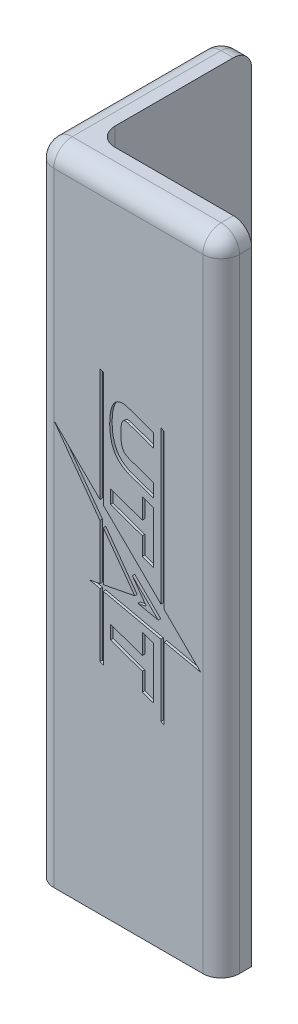
from build123d import *

# Parameters (mm, degrees)
SKETCH1_W           = 25.4
SKETCH1_H           = 100
BOSS_EXTRUDE1_DEPTH = 5
SKETCH2_W           = 5
SKETCH2_H           = 100
BOSS_EXTRUDE2_DEPTH = 30.4
BOSS_EXTRUDE3_DEPTH = 5
FILLET1_R           = 3
FILLET2_R           = 3
FILLET3_R           = 3
FILLET4_R           = 3
CUT_EXTRUDE1_START  = -0.4
CUT_EXTRUDE1_DEPTH  = 0.4
SKETCH5_W           = 0.314102564
SKETCH5_H           = 2.557692308
CUT_EXTRUDE2_DEPTH  = 0.4


# Read off the part's stored shape, not the designer's step: Cut-Extrude1
with BuildPart() as part:
    # Sketch1 → Boss-Extrude1 (new body)
    with BuildSketch(Plane.XY):
        Rectangle(SKETCH1_W, SKETCH1_H)
    extrude(amount=BOSS_EXTRUDE1_DEPTH)

    # Sketch2 → Boss-Extrude2 (add)
    with BuildSketch(Plane.XY.offset(5)):
        with Locations((-15.2, 0)):
            Rectangle(SKETCH2_W, SKETCH2_H)
    extrude(amount=-BOSS_EXTRUDE2_DEPTH)

    # Sketch3 → Boss-Extrude3 (add)
    with BuildSketch(Plane.XZ.offset(50)):
        Polygon((12.7, 0), (-12.7, -25.4), (-17.7, -25.4), (-17.7, 5), (12.7, 5), align=None)
    extrude(amount=BOSS_EXTRUDE3_DEPTH)

    # Fillet1
    fillet1_edges = [part.edges().sort_by_distance(p)[0] for p in [
        (-12.7, -50, -12.7),
        (0, -50, 0),
        (-12.7, 0, 0),
    ]]
    fillet(fillet1_edges, radius=FILLET1_R)

    # Fillet2
    fillet2_edges = [part.edges().sort_by_distance(p)[0] for p in [
        (-17.7, -2.5, -25.4),
        (-17.7, -2.5, 5),
        (12.7, -2.5, 5),
        (-2.5, 50, 5),
    ]]
    fillet(fillet2_edges, radius=FILLET2_R)

    # Fillet3
    # the kernel refuses this fillet: 3 mm, written as the material it takes off along each edge
    with BuildSketch(Plane(origin=(-14.7, 47, 2), x_dir=(-1, 0, 0), z_dir=(0, 1, 0))) as fillet3_piece_1_section:
        Polygon((0, 0), (FILLET3_R, 0), (FILLET3_R, FILLET3_R), (0, FILLET3_R), align=None)
    fillet3_piece_1 = extrude(amount=FILLET3_R, mode=Mode.PRIVATE)
    fillet3_piece_1 = fillet3_piece_1 - Plane(origin=(-14.7, 47, 2), x_dir=(0.7071067811865475, 0, -0.7071067811865475), z_dir=(0, 1, 0)) * Sphere(FILLET3_R, mode=Mode.PRIVATE)
    add(fillet3_piece_1, mode=Mode.SUBTRACT)
    with BuildSketch(Plane(origin=(-5.2, 50, -25.4), x_dir=(0, 0, 1), z_dir=(-1, 0, 0))) as fillet3_piece_2:
        with BuildLine():
            CenterArc((FILLET3_R, -FILLET3_R), FILLET3_R, 90, 90)
            Line((0, -FILLET3_R), (0, 0))
            Line((0, 0), (FILLET3_R, 0))
        make_face()
    extrude(amount=9.5, mode=Mode.SUBTRACT)
    with BuildSketch(Plane(origin=(-17.7, 50, 2), x_dir=(1, 0, 0), z_dir=(0, 0, -1))) as fillet3_piece_3:
        with BuildLine():
            CenterArc((FILLET3_R, FILLET3_R), FILLET3_R, 180, 90)
            Line((0, FILLET3_R), (0, 0))
            Line((0, 0), (FILLET3_R, 0))
        make_face()
    extrude(amount=24.4, mode=Mode.SUBTRACT)
    with BuildSketch(Plane(origin=(-14.7, 50, -22.4), x_dir=(-1, 0, 0), z_dir=(0, 0, 1))) as fillet3_piece_4:
        with BuildLine():
            CenterArc((3 - FILLET3_R, FILLET3_R), FILLET3_R, 270, 90)
            Line((3, FILLET3_R), (3, 0))
            Line((3, 0), (3 - FILLET3_R, 0))
        make_face()
    revolve(axis=Axis((-14.7, 50, -22.4), (0, -1, 0)), revolution_arc=90, mode=Mode.SUBTRACT)

    # Fillet4
    # the kernel refuses this fillet: 3 mm, written as the material it takes off along each edge
    with BuildSketch(Plane(origin=(9.7, 47, 2), x_dir=(1, 0, 0), z_dir=(0, 1, 0))) as fillet4_piece_1_section:
        Polygon((0, 0), (FILLET4_R, 0), (FILLET4_R, -FILLET4_R), (0, -FILLET4_R), align=None)
    fillet4_piece_1 = extrude(amount=FILLET4_R, mode=Mode.PRIVATE)
    fillet4_piece_1 = fillet4_piece_1 - Plane(origin=(9.7, 47, 2), x_dir=(-0.7071067811865475, 0, -0.7071067811865475), z_dir=(0, 1, 0)) * Sphere(FILLET4_R, mode=Mode.PRIVATE)
    add(fillet4_piece_1, mode=Mode.SUBTRACT)
    with BuildSketch(Plane(origin=(12.7, 50, -7.5), x_dir=(-1, 0, 0), z_dir=(0, 0, 1))) as fillet4_piece_2:
        with BuildLine():
            CenterArc((FILLET4_R, FILLET4_R), FILLET4_R, 180, 90)
            Line((0, FILLET4_R), (0, 0))
            Line((0, 0), (FILLET4_R, 0))
        make_face()
    extrude(amount=9.5, mode=Mode.SUBTRACT)

    # Cut-Extrude1 outline → Cut-Extrude1 (cut)
    # profile 1 of 4: a face of its own
    with BuildSketch(Plane.XY.offset(5).offset(CUT_EXTRUDE1_START)):
        with BuildLine():
            Line((1.645380209, 17.682917319), (-2.642067311, 19.188059032))
            add(Edge.make_bspline(
                [(-2.642067311, 19.188059032), (-2.801200075, 19.232650803), (-2.976144999, 19.272472548), (-3.323876675, 19.317451019), (-3.498126802, 19.323191147), (-3.839106834, 19.286973095), (-4.006159349, 19.245053084), (-4.325340549, 19.101871815), (-4.477347509, 19.000476363), (-4.756479391, 18.730845616), (-4.883463975, 18.562522822), (-5.105358898, 18.159723445), (-5.200266583, 17.925279253), (-5.434058371, 17.137502224), (-5.52259268, 16.498535316), (-5.575448942, 15.137748495), (-5.541060665, 14.417748791), (-5.374578808, 13.397224638), (-5.299424723, 13.06696379), (-5.105665434, 12.444626305), (-4.98689332, 12.152716073), (-4.707982457, 11.6212962), (-4.547868114, 11.382021025), (-4.197822474, 10.959462193), (-4.008277099, 10.776191859), (-3.614762131, 10.453442793), (-3.411385687, 10.313097417), (-3.097952368, 10.121764898), (-2.991901525, 10.061202649), (-2.77486058, 9.947734844), (-2.663804274, 9.894688519), (-2.549169917, 9.849066737)],
                knots=[0, 0, 0, 0, 0.0625, 0.0625, 0.125, 0.125, 0.1875, 0.1875, 0.25, 0.25, 0.3125, 0.3125, 0.375, 0.375, 0.5, 0.5, 0.625, 0.625, 0.6875, 0.6875, 0.75, 0.75, 0.8125, 0.8125, 0.875, 0.875, 0.9375, 0.9375, 0.96875, 0.96875, 1, 1, 1, 1], degree=3))
            Line((-2.549169917, 9.849066737), (1.645380209, 8.376537762))
            Line((1.645380209, 8.376537762), (1.645380269, 10.58172453))
            Line((1.645380269, 10.58172453), (-2.374981983, 11.993103154))
            add(Edge.make_bspline(
                [(-2.374981983, 11.993103154), (-2.438543495, 12.023304543), (-2.517307531, 12.061688928), (-2.694418178, 12.148219611), (-2.791899148, 12.197619215), (-2.984415327, 12.322421309), (-3.079212931, 12.398255188), (-3.251768669, 12.586599957), (-3.329560308, 12.699138935), (-3.462790247, 12.960568422), (-3.518341685, 13.10933293), (-3.608223534, 13.43420779), (-3.642658684, 13.610171929), (-3.720185685, 14.159342074), (-3.738354538, 14.55241015), (-3.73619539, 15.295138032), (-3.716367942, 15.644731671), (-3.638028303, 16.243693339), (-3.5789285, 16.49416828), (-3.437209448, 16.767920919), (-3.380883508, 16.842148416), (-3.247335423, 16.952784753), (-3.169885451, 16.9889974), (-2.997738688, 17.023988747), (-2.90271205, 17.022346288), (-2.714108837, 16.995175625), (-2.620183173, 16.968886331), (-2.549169858, 16.95263838)],
                knots=[0, 0, 0, 0, 0.0625, 0.0625, 0.125, 0.125, 0.1875, 0.1875, 0.25, 0.25, 0.3125, 0.3125, 0.375, 0.375, 0.5, 0.5, 0.625, 0.625, 0.75, 0.75, 0.8125, 0.8125, 0.875, 0.875, 0.9375, 0.9375, 1, 1, 1, 1], degree=3))
            Line((-2.549169858, 16.95263838), (1.645380209, 15.480108015))
            Line((1.645380209, 15.480108015), (1.645380209, 17.682917319))
        make_face()
    # profile 2 of 4: a face of its own
    with BuildSketch(Plane.XY.offset(5).offset(CUT_EXTRUDE1_START)):
        Polygon((-0.200299968, -20.013397732), (1.645380209, -20.664639272), (1.645380209, -12.17238883), (-0.21205758, -11.520321169), (-0.21205758, -14.838971891), (-5.412489523, -13.00402502), (-5.412489523, -15.224820175), (-0.200299968, -17.063914337), align=None)
    # profile 3 of 4: a face of its own
    with BuildSketch(Plane.XY.offset(5).offset(CUT_EXTRUDE1_START)):
        Polygon((-0.21205758, -0.802293815), (1.645380209, -1.45422379), (1.645380209, 7.034507296), (-0.21205758, 7.689894042), (-0.21205758, 4.361306927), (-5.439937164, 6.196207903), (-5.439937164, 3.985119663), (-0.21205758, 2.150218687), align=None)
    # profile 4 of 4: a face of its own
    with BuildSketch(Plane.XY.offset(5).offset(CUT_EXTRUDE1_START)):
        Polygon((3.360443662, -11.124054589), (9.364861797, -12.450307407), (3.36157019, -6.530124345), (3.36157019, 18.765806756), (2.831215511, 18.966581128), (2.831215511, -6.015960374), (-6.602546175, 3.28720232), (-6.602546175, 22.153214268), (-7.145439734, 22.346713147), (-7.145439734, 3.822580478), (-14.7, 11.272556982), (-7.145439734, 0.849446259), (-7.145439734, -8.096169033), (-8.800724198, -8.437899151), (-7.138373901, -8.805076279), (-7.138373901, -19.173291721), (-6.602546175, -19.372082152), (-6.602546175, -8.923432626), (2.831215511, -11.007158556), (2.831215511, -22.660420933), (3.360443662, -22.856766381), align=None)
        Polygon((-6.601606359, 0.099114082), (-1.462521155, -6.991337337), (-6.601606359, -7.983395257), align=None, mode=Mode.SUBTRACT)
        Polygon((2.399828385, -8.506788411), (-0.92899238, -7.808040776), (0.44099475, -7.549352445), (-1.848042955, -4.338758685), align=None, mode=Mode.SUBTRACT)
    extrude(amount=CUT_EXTRUDE1_DEPTH, mode=Mode.SUBTRACT)

    # Sketch5 → Cut-Extrude2 (cut)
    with BuildSketch(Plane.ZY.offset(17.7)):
        Polygon((-17.336726826, 2.778801547), (-16.68959141, 2.778801547), (-16.68959141, -0.721198453), (-17.003693974, -0.721198453), (-17.003693974, 2.419827188), (-17.542155512, 2.419827188), align=None)
        with BuildLine():
            add(Edge.make_bspline(
                [(-15.05317314, 2.913416932), (-15.033681825, 2.912512779), (-14.995514085, 2.910742275), (-14.940320817, 2.895580798), (-14.890063805, 2.869881113), (-14.845486072, 2.835401432), (-14.807234186, 2.794851989), (-14.780453475, 2.74759102), (-14.763241079, 2.696532381), (-14.761162524, 2.660917292), (-14.76010423, 2.642783919)],
                knots=[0, 0, 0, 0, 1.055194115, 2.066272739, 3.074728998, 4.095836921, 5.109056067, 6.073838105, 7.019297344, 8, 8, 8, 8], degree=3))
            add(Edge.make_bspline(
                [(-14.76010423, 2.642783919), (-14.76118639, 2.625121266), (-14.763325692, 2.590204291), (-14.78044018, 2.540030819), (-14.807462418, 2.493426535), (-14.845461544, 2.452955825), (-14.890070305, 2.418495205), (-14.940319091, 2.392790466), (-14.995514539, 2.377630329), (-15.033681978, 2.37585964), (-15.05317314, 2.374955393)],
                knots=[0, 0, 0, 0, 0.96129708, 1.900370562, 2.859976407, 3.87933698, 4.906634145, 5.921202961, 6.938410037, 8, 8, 8, 8], degree=3))
            add(Edge.make_bspline(
                [(-15.05317314, 2.374955393), (-15.072441416, 2.375825114), (-15.109944596, 2.37751791), (-15.164311438, 2.393087928), (-15.214139928, 2.418504001), (-15.2588046, 2.452730186), (-15.296034793, 2.493675084), (-15.323133119, 2.540002377), (-15.340208081, 2.590211532), (-15.342352709, 2.625123698), (-15.343437564, 2.642783919)],
                knots=[0, 0, 0, 0, 1.054934014, 2.053291228, 3.073705704, 4.106921865, 5.123545215, 6.088680038, 7.033164197, 8, 8, 8, 8], degree=3))
            add(Edge.make_bspline(
                [(-15.343437564, 2.642783919), (-15.342376477, 2.660914769), (-15.340292436, 2.696524901), (-15.32312032, 2.747619934), (-15.296260512, 2.794601436), (-15.258779948, 2.835626935), (-15.214146488, 2.86987237), (-15.164309743, 2.895283352), (-15.109945044, 2.910854691), (-15.072441568, 2.912547305), (-15.05317314, 2.913416932)],
                knots=[0, 0, 0, 0, 0.98631895, 1.937192651, 2.907499808, 3.917963147, 4.944918757, 5.95915025, 6.951458133, 8, 8, 8, 8], degree=3))
        make_face()
        with Locations((-15.051770897, 0.557647701)):
            Rectangle(SKETCH5_W, SKETCH5_H)
        with BuildLine():
            Line((-14.131899102, 1.836493855), (-13.817796538, 1.836493855))
            Line((-13.817796538, 1.836493855), (-13.817796538, 1.375155714))
            add(Edge.make_bspline(
                [(-13.817796538, 1.375155714), (-13.784258903, 1.416998437), (-13.719177952, 1.4981957), (-13.610793618, 1.604916275), (-13.496249718, 1.6928615), (-13.376247715, 1.762965294), (-13.250624705, 1.81581192), (-13.120146435, 1.853977851), (-12.984031728, 1.87686268), (-12.891467292, 1.87985291), (-12.844639487, 1.88136565)],
                knots=[0, 0, 0, 0, 1.12780773, 2.188550248, 3.19190651, 4.159438251, 5.104880172, 6.052711206, 7.014878035, 8, 8, 8, 8], degree=3))
            add(Edge.make_bspline(
                [(-12.844639487, 1.88136565), (-12.797308853, 1.879620454), (-12.704671385, 1.876204686), (-12.569793323, 1.849187995), (-12.44381993, 1.80304274), (-12.327200374, 1.739830669), (-12.222073161, 1.661224196), (-12.129748309, 1.569646414), (-12.053385062, 1.464310331), (-12.002187699, 1.366587175), (-11.968462051, 1.27989838), (-11.947229713, 1.20565163), (-11.929198732, 1.122933479), (-11.913566984, 1.03199389), (-11.902989872, 0.9321957), (-11.894647581, 0.823948008), (-11.888668886, 0.707285877), (-11.888431679, 0.62659925), (-11.888309358, 0.584991451)],
                knots=[0, 0, 0, 0, 1.235846778, 2.418850247, 3.575807741, 4.728682307, 5.871620074, 6.994088408, 8.11269785, 9.256955736, 9.865816715, 10.540099792, 11.271859618, 12.076849838, 12.949306005, 13.892391288, 14.913166135, 16, 16, 16, 16], degree=3))
            Line((-11.888309358, 0.584991451), (-11.888309358, -0.721198453))
            Line((-11.888309358, -0.721198453), (-12.202411923, -0.721198453))
            Line((-12.202411923, -0.721198453), (-12.202411923, 0.481926547))
            add(Edge.make_bspline(
                [(-12.202411923, 0.481926547), (-12.202605131, 0.516748992), (-12.202974705, 0.583358403), (-12.204140351, 0.678727426), (-12.206950158, 0.765214005), (-12.210898471, 0.842611372), (-12.216677501, 0.910845208), (-12.222700133, 0.970054485), (-12.230065109, 1.020164028), (-12.236628023, 1.05032911), (-12.239571378, 1.063857637)],
                knots=[0, 0, 0, 0, 1.430800155, 2.736877192, 3.918605307, 4.986035426, 5.920637409, 6.731861385, 7.431261377, 8, 8, 8, 8], degree=3))
            add(Edge.make_bspline(
                [(-12.239571378, 1.063857637), (-12.250196909, 1.103568822), (-12.27064777, 1.180000567), (-12.321181753, 1.283674919), (-12.384995934, 1.371873107), (-12.462893783, 1.444049829), (-12.554122859, 1.500220665), (-12.658430002, 1.53919462), (-12.774808642, 1.563570889), (-12.856663025, 1.565998021), (-12.899326987, 1.567263086)],
                knots=[0, 0, 0, 0, 1.084156227, 2.086665306, 3.027808233, 3.945421172, 4.874247719, 5.839848303, 6.874090471, 8, 8, 8, 8], degree=3))
            add(Edge.make_bspline(
                [(-12.899326987, 1.567263086), (-12.92459467, 1.566787081), (-12.974598763, 1.56584508), (-13.048748735, 1.556393782), (-13.120672908, 1.540935326), (-13.191093117, 1.520066689), (-13.258600911, 1.49140442), (-13.325365202, 1.45887505), (-13.388871966, 1.418326838), (-13.450475363, 1.373136216), (-13.507788171, 1.323057009), (-13.56111651, 1.270212499), (-13.60865453, 1.213936895), (-13.651723205, 1.155136947), (-13.688901468, 1.093005109), (-13.721354557, 1.028140803), (-13.748890251, 0.960458654), (-13.762572944, 0.913483593), (-13.769419134, 0.889979432)],
                knots=[0, 0, 0, 0, 1.023777757, 2.026029729, 3.023749952, 4.003683103, 4.997618607, 5.993177895, 7.010360494, 8.046726602, 9.087585522, 10.09234134, 11.086953743, 12.070360549, 13.043493632, 14.017870808, 15.008233677, 16, 16, 16, 16], degree=3))
            add(Edge.make_bspline(
                [(-13.769419134, 0.889979432), (-13.773358783, 0.872724229), (-13.781935191, 0.835160554), (-13.791198371, 0.773516135), (-13.799605947, 0.70220616), (-13.806642905, 0.621313843), (-13.810948322, 0.530555968), (-13.815642719, 0.43032013), (-13.81735178, 0.320206642), (-13.817644134, 0.243544949), (-13.817796538, 0.203581195)],
                knots=[0, 0, 0, 0, 0.615963638, 1.340920617, 2.168419149, 3.115676021, 4.16674242, 5.331190069, 6.6087489, 8, 8, 8, 8], degree=3))
            Line((-13.817796538, 0.203581195), (-13.817796538, -0.721198453))
            Line((-13.817796538, -0.721198453), (-14.131899102, -0.721198453))
            Line((-14.131899102, -0.721198453), (-14.131899102, 1.836493855))
        make_face()
        Polygon((-10.676770897, 2.868545137), (-10.407540128, 2.868545137), (-10.467836602, 2.161113246), (-9.891514487, 2.580384079), (-9.734463205, 2.313957797), (-10.393517692, 2.015981034), (-9.734463205, 1.723613246), (-9.891514487, 1.45578472), (-10.467836602, 1.868745457), (-10.407540128, 1.163416932), (-10.676770897, 1.163416932), (-10.612267692, 1.868745457), (-11.192095416, 1.45578472), (-11.34984782, 1.723613246), (-10.676770897, 2.015981034), (-11.34984782, 2.313957797), (-11.192095416, 2.580384079), (-10.612267692, 2.163917733), align=None)
        Polygon((-8.631598621, 2.778801547), (-7.984463205, 2.778801547), (-7.984463205, -0.721198453), (-8.298565769, -0.721198453), (-8.298565769, 2.419827188), (-8.837027307, 2.419827188), align=None)
        with BuildLine():
            add(Edge.make_bspline(
                [(-6.348044935, 2.913416932), (-6.32855362, 2.912512779), (-6.29038588, 2.910742275), (-6.235192612, 2.895580798), (-6.1849356, 2.869881113), (-6.140357867, 2.835401432), (-6.10210598, 2.794851989), (-6.07532527, 2.74759102), (-6.058112874, 2.696532381), (-6.056034319, 2.660917292), (-6.054976025, 2.642783919)],
                knots=[0, 0, 0, 0, 1.055194115, 2.066272739, 3.074728998, 4.095836921, 5.109056067, 6.073838105, 7.019297344, 8, 8, 8, 8], degree=3))
            add(Edge.make_bspline(
                [(-6.054976025, 2.642783919), (-6.056058185, 2.625121266), (-6.058197487, 2.590204291), (-6.075311975, 2.540030819), (-6.102334213, 2.493426535), (-6.140333339, 2.452955825), (-6.1849421, 2.418495205), (-6.235190885, 2.392790466), (-6.290386334, 2.377630329), (-6.328553773, 2.37585964), (-6.348044935, 2.374955393)],
                knots=[0, 0, 0, 0, 0.96129708, 1.900370562, 2.859976407, 3.87933698, 4.906634145, 5.921202961, 6.938410037, 8, 8, 8, 8], degree=3))
            add(Edge.make_bspline(
                [(-6.348044935, 2.374955393), (-6.367313211, 2.375825114), (-6.404816391, 2.37751791), (-6.459183233, 2.393087928), (-6.509011722, 2.418504001), (-6.553676395, 2.452730186), (-6.590906588, 2.493675084), (-6.618004914, 2.540002377), (-6.635079875, 2.590211532), (-6.637224504, 2.625123698), (-6.638309358, 2.642783919)],
                knots=[0, 0, 0, 0, 1.054934014, 2.053291228, 3.073705704, 4.106921865, 5.123545215, 6.088680038, 7.033164197, 8, 8, 8, 8], degree=3))
            add(Edge.make_bspline(
                [(-6.638309358, 2.642783919), (-6.637248272, 2.660914769), (-6.635164231, 2.696524901), (-6.617992115, 2.747619934), (-6.591132307, 2.794601436), (-6.553651743, 2.835626935), (-6.509018283, 2.86987237), (-6.459181538, 2.895283352), (-6.404816838, 2.910854691), (-6.367313362, 2.912547305), (-6.348044935, 2.913416932)],
                knots=[0, 0, 0, 0, 0.98631895, 1.937192651, 2.907499808, 3.917963147, 4.944918757, 5.95915025, 6.951458133, 8, 8, 8, 8], degree=3))
        make_face()
        with Locations((-6.346642692, 0.557647701)):
            Rectangle(SKETCH5_W, SKETCH5_H)
        with BuildLine():
            Line((-5.426770897, 1.836493855), (-5.112668333, 1.836493855))
            Line((-5.112668333, 1.836493855), (-5.112668333, 1.375155714))
            add(Edge.make_bspline(
                [(-5.112668333, 1.375155714), (-5.079130698, 1.416998437), (-5.014049747, 1.4981957), (-4.905665413, 1.604916275), (-4.791121513, 1.6928615), (-4.67111951, 1.762965294), (-4.545496499, 1.81581192), (-4.415018229, 1.853977851), (-4.278903523, 1.87686268), (-4.186339086, 1.87985291), (-4.139511281, 1.88136565)],
                knots=[0, 0, 0, 0, 1.12780773, 2.188550248, 3.19190651, 4.159438251, 5.104880172, 6.052711206, 7.014878035, 8, 8, 8, 8], degree=3))
            add(Edge.make_bspline(
                [(-4.139511281, 1.88136565), (-4.092180647, 1.879620454), (-3.99954318, 1.876204686), (-3.864665118, 1.849187995), (-3.738691725, 1.80304274), (-3.622072169, 1.739830669), (-3.516944955, 1.661224196), (-3.424620104, 1.569646414), (-3.348256857, 1.464310331), (-3.297059494, 1.366587175), (-3.263333846, 1.27989838), (-3.242101508, 1.20565163), (-3.224070527, 1.122933479), (-3.208438779, 1.03199389), (-3.197861667, 0.9321957), (-3.189519375, 0.823948008), (-3.183540681, 0.707285877), (-3.183303474, 0.62659925), (-3.183181153, 0.584991451)],
                knots=[0, 0, 0, 0, 1.235846778, 2.418850247, 3.575807741, 4.728682307, 5.871620074, 6.994088408, 8.11269785, 9.256955736, 9.865816715, 10.540099792, 11.271859618, 12.076849838, 12.949306005, 13.892391288, 14.913166135, 16, 16, 16, 16], degree=3))
            Line((-3.183181153, 0.584991451), (-3.183181153, -0.721198453))
            Line((-3.183181153, -0.721198453), (-3.497283717, -0.721198453))
            Line((-3.497283717, -0.721198453), (-3.497283717, 0.481926547))
            add(Edge.make_bspline(
                [(-3.497283717, 0.481926547), (-3.497476925, 0.516748992), (-3.497846499, 0.583358403), (-3.499012146, 0.678727426), (-3.501821953, 0.765214005), (-3.505770266, 0.842611372), (-3.511549296, 0.910845208), (-3.517571928, 0.970054485), (-3.524936904, 1.020164028), (-3.531499817, 1.05032911), (-3.534443173, 1.063857637)],
                knots=[0, 0, 0, 0, 1.430800155, 2.736877192, 3.918605307, 4.986035426, 5.920637409, 6.731861385, 7.431261377, 8, 8, 8, 8], degree=3))
            add(Edge.make_bspline(
                [(-3.534443173, 1.063857637), (-3.545068704, 1.103568822), (-3.565519565, 1.180000567), (-3.616053548, 1.283674919), (-3.679867729, 1.371873107), (-3.757765578, 1.444049829), (-3.848994654, 1.500220665), (-3.953301796, 1.53919462), (-4.069680437, 1.563570889), (-4.15153482, 1.565998021), (-4.194198781, 1.567263086)],
                knots=[0, 0, 0, 0, 1.084156227, 2.086665306, 3.027808233, 3.945421172, 4.874247719, 5.839848303, 6.874090471, 8, 8, 8, 8], degree=3))
            add(Edge.make_bspline(
                [(-4.194198781, 1.567263086), (-4.219466465, 1.566787081), (-4.269470558, 1.56584508), (-4.34362053, 1.556393782), (-4.415544703, 1.540935326), (-4.485964912, 1.520066689), (-4.553472706, 1.49140442), (-4.620236997, 1.45887505), (-4.683743761, 1.418326838), (-4.745347158, 1.373136216), (-4.802659966, 1.323057009), (-4.855988304, 1.270212499), (-4.903526325, 1.213936895), (-4.946595, 1.155136947), (-4.983773263, 1.093005109), (-5.016226351, 1.028140803), (-5.043762046, 0.960458654), (-5.057444739, 0.913483593), (-5.064290929, 0.889979432)],
                knots=[0, 0, 0, 0, 1.023777757, 2.026029729, 3.023749952, 4.003683103, 4.997618607, 5.993177895, 7.010360494, 8.046726602, 9.087585522, 10.09234134, 11.086953743, 12.070360549, 13.043493632, 14.017870808, 15.008233677, 16, 16, 16, 16], degree=3))
            add(Edge.make_bspline(
                [(-5.064290929, 0.889979432), (-5.068230578, 0.872724229), (-5.076806986, 0.835160554), (-5.086070166, 0.773516135), (-5.094477742, 0.70220616), (-5.1015147, 0.621313843), (-5.105820117, 0.530555968), (-5.110514513, 0.43032013), (-5.112223575, 0.320206642), (-5.112515929, 0.243544949), (-5.112668333, 0.203581195)],
                knots=[0, 0, 0, 0, 0.615963638, 1.340920617, 2.168419149, 3.115676021, 4.16674242, 5.331190069, 6.6087489, 8, 8, 8, 8], degree=3))
            Line((-5.112668333, 0.203581195), (-5.112668333, -0.721198453))
            Line((-5.112668333, -0.721198453), (-5.426770897, -0.721198453))
            Line((-5.426770897, -0.721198453), (-5.426770897, 1.836493855))
        make_face()
    extrude(amount=-CUT_EXTRUDE2_DEPTH, mode=Mode.SUBTRACT)


solid = part.part
